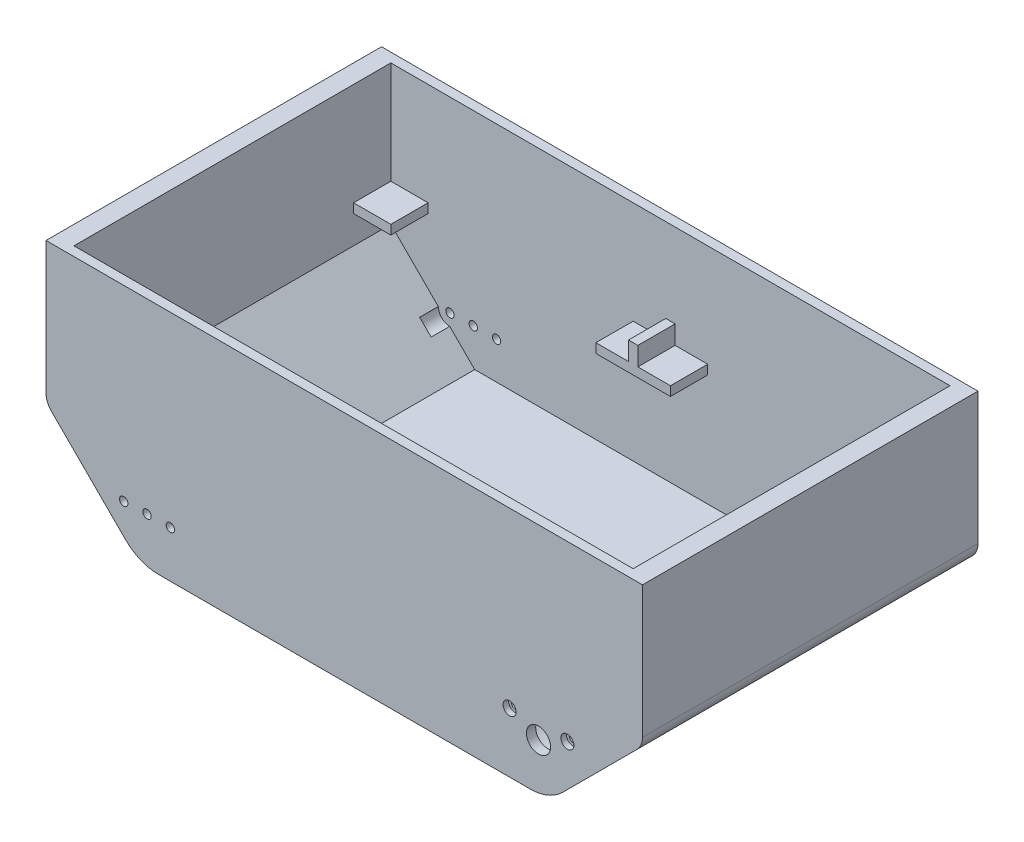
from build123d import *

# Parameters (mm, degrees)
SKETCH1_W               = 320
SKETCH1_H               = 180
BOSS_EXTRUDE1_DEPTH     = 50
CUT_EXTRUDE2_DEPTH      = 246.967477525
CUT_EXTRUDE3_DEPTH      = 170
FILLET1_R               = 25
SKETCH6_R               = 6.5
CUT_EXTRUDE4_DEPTH      = 246.967477525
SKETCH11_R              = 2
CUT_EXTRUDE7_DEPTH      = 246.967477525
SKETCH12_R              = 3.5
SKETCH12_R_2            = 2
CUT_EXTRUDE8_DEPTH      = 3
BOSS_EXTRUDE2_DEPTH     = 170
SKETCH13_R              = 2.25
CUT_EXTRUDE9_DEPTH      = 246.967477525
SKETCH7_R               = 17.75
CUT_EXTRUDE11_DEPTH     = 170
CUT_EXTRUDE10_DEPTH     = 10
FILLET2_R               = 25
SKETCH15_R              = 18.75
CUT_EXTRUDE12_DEPTH     = 50
SKETCH16_W              = 320
SKETCH16_H              = 180
SKETCH16_W_2            = 300
SKETCH16_H_2            = 170
BOSS_EXTRUDE4_DEPTH     = 75
FILLET3_R               = 10
SKETCH17_W              = 20
SKETCH17_H              = 20
BOSS_EXTRUDE5_DEPTH     = 5
LPATTERN1_COUNT         = 2
LPATTERN1_PITCH         = 150
LPATTERN1_COUNT_DIR2    = 2
LPATTERN1_PITCH_DIR2    = 130
MIRROR6_COPY_1_SKETCH_W = 20
MIRROR6_COPY_1_SKETCH_H = 20
MIRROR6_COPY_1_DEPTH    = 5
MIRROR6_COPY_2_SKETCH_W = 20
MIRROR6_COPY_2_SKETCH_H = 20
MIRROR6_COPY_2_DEPTH    = 5
MIRROR6_COPY_3_SKETCH_W = 20
MIRROR6_COPY_3_SKETCH_H = 20
MIRROR6_COPY_3_DEPTH    = 5
SKETCH18_W              = 5
SKETCH18_H              = 20
BOSS_EXTRUDE6_DEPTH     = 10


with BuildPart() as part:
    # Sketch1 → Boss-Extrude1 (new body)
    with BuildSketch(Plane(origin=(0, 0, 0), x_dir=(1, 0, 0), z_dir=(0, 1, 0))):
        Rectangle(SKETCH1_W, SKETCH1_H)
    extrude(amount=BOSS_EXTRUDE1_DEPTH)

    # Sketch2 → Cut-Extrude2 (cut, through all)
    with BuildSketch(Plane.XY.offset(90)):
        Polygon((-160, 50), (-110, 0), (-160, 0), align=None)
    cut_extrude2 = extrude(amount=-CUT_EXTRUDE2_DEPTH, mode=Mode.SUBTRACT)

    # Mirror1: Cut-Extrude2 across plane
    add(cut_extrude2.mirror(Plane(origin=(0, 0, 0), x_dir=(0, 0, 1), z_dir=(1, 0, 0))), mode=Mode.SUBTRACT)

    # Sketch5 → Cut-Extrude3 (cut)
    with BuildSketch(Plane.XY.offset(85)):
        Polygon((-150, 50), (150, 50), (105, 5), (-105, 5), align=None)
    extrude(amount=-CUT_EXTRUDE3_DEPTH, mode=Mode.SUBTRACT)

    # Fillet1
    fillet1_edges = [part.edges().sort_by_distance(p)[0] for p in [
        (-110, 0, 0),
        (110, 0, 0),
    ]]
    fillet(fillet1_edges, radius=FILLET1_R)

    # Sketch6 → Cut-Extrude4 (cut, through all)
    with BuildSketch(Plane(origin=(0, 0, -90), x_dir=(-1, 0, 0), z_dir=(0, 0, -1))):
        with Locations((-104.21174675, 25)):
            Circle(SKETCH6_R)
    extrude(amount=-CUT_EXTRUDE4_DEPTH, mode=Mode.SUBTRACT)

    # Sketch11 → Cut-Extrude7 (cut, through all)
    with BuildSketch(Plane(origin=(0, 0, -90), x_dir=(-1, 0, 0), z_dir=(0, 0, -1))):
        with Locations((-88.71174675, 32)):
            Circle(SKETCH11_R)
        with Locations((-119.71174675, 32)):
            Circle(SKETCH11_R)
    extrude(amount=-CUT_EXTRUDE7_DEPTH, mode=Mode.SUBTRACT)

    # Sketch12 → Cut-Extrude8 (cut)
    # profile 1 of 2: a face of its own
    with BuildSketch(Plane(origin=(0, 0, -90), x_dir=(-1, 0, 0), z_dir=(0, 0, -1))):
        with Locations((-88.71174675, 32)):
            Circle(SKETCH12_R)
        with Locations((-88.71174675, 32)):
            Circle(SKETCH12_R_2, mode=Mode.SUBTRACT)
    # profile 2 of 2: a face of its own
    with BuildSketch(Plane(origin=(0, 0, -90), x_dir=(-1, 0, 0), z_dir=(0, 0, -1))):
        with Locations((-119.71174675, 32)):
            Circle(SKETCH12_R)
    cut_extrude8 = extrude(amount=-CUT_EXTRUDE8_DEPTH, mode=Mode.SUBTRACT)

    # Mirror3: Cut-Extrude8 across plane
    add(cut_extrude8.mirror(Plane.XY), mode=Mode.SUBTRACT)

    # Sketch8 → Boss-Extrude2 (add)
    with BuildSketch(Plane.XY.offset(-85)):
        Polygon((134.775557817, 25), (113.988971092, 4.88785045), (73.113118158, 4.88785045), (73.113118158, 25), align=None)
    extrude(amount=BOSS_EXTRUDE2_DEPTH)

    # Sketch13 → Cut-Extrude9 (cut, through all)
    with BuildSketch(Plane(origin=(0, 0, -90), x_dir=(-1, 0, 0), z_dir=(0, 0, -1))):
        with Locations((105.78825325, 25)):
            Circle(SKETCH13_R)
        with Locations((118.28825325, 24.639652806)):
            Circle(SKETCH13_R)
        with Locations((93.28825325, 25)):
            Circle(SKETCH13_R)
    extrude(amount=-CUT_EXTRUDE9_DEPTH, mode=Mode.SUBTRACT)

    # Sketch7 → Cut-Extrude11 (cut)
    with BuildSketch(Plane.XY.offset(-85)):
        with Locations((104.21174675, 32)):
            Circle(SKETCH7_R)
    extrude(amount=CUT_EXTRUDE11_DEPTH, mode=Mode.SUBTRACT)

    # Sketch14 → Cut-Extrude10 (cut)
    with BuildSketch(Plane(origin=(0, 0, 85), x_dir=(-1, 0, 0), z_dir=(0, 0, -1))):
        with BuildLine():
            Line((93.378330692, 31.249350851), (118.378330692, 30.889003656))
            ThreePointArc((118.378330692, 30.889003656), (124.537604101, 24.549575364), (118.198175808, 18.390301955))
            Line((118.198175808, 18.390301955), (93.198175808, 18.750649149))
            ThreePointArc((93.198175808, 18.750649149), (87.0389024, 25.090077442), (93.378330692, 31.249350851))
        make_face()
    cut_extrude10 = extrude(amount=CUT_EXTRUDE10_DEPTH, mode=Mode.SUBTRACT)

    # Mirror4: Cut-Extrude10 across plane
    add(cut_extrude10.mirror(Plane.XY), mode=Mode.SUBTRACT)

    # Fillet2
    # the kernel refuses this fillet: 25 mm, written as the material it adds along each edge
    with BuildSketch(Plane(origin=(125, 25, 85), x_dir=(0.7071067811865477, 0.7071067811865474, 0), z_dir=(0, 0, -1))) as fillet2_piece_1:
        with BuildLine():
            CenterArc((9.010562274, -25), FILLET2_R, 90, 29.146633508)
            Line((-3.165597468, -3.165597468), (-3.409120663, -2.728909417))
            ThreePointArc((-3.409120663, -2.728909417), (-1.936352125, -1.229245343), (-0.353553391, 0.353553391))
            Line((-0.353553391, 0.353553391), (0, 0.5))
            Line((0, 0.5), (9.010562274, 0.5))
            Line((9.010562274, 0.5), (9.010562274, 0))
        make_face()
    extrude(amount=170)

    # Sketch15 → Cut-Extrude12 (cut)
    with BuildSketch(Plane.XY.offset(-85)):
        with Locations((104.21174675, 32)):
            Circle(SKETCH15_R)
    cut_extrude12 = extrude(amount=CUT_EXTRUDE12_DEPTH, mode=Mode.SUBTRACT)

    # Mirror5: Cut-Extrude12 across plane
    add(cut_extrude12.mirror(Plane.XY), mode=Mode.SUBTRACT)

    # Sketch16 → Boss-Extrude4 (add)
    with BuildSketch(Plane(origin=(0, 50, 0), x_dir=(1, 0, 0), z_dir=(0, 1, 0))):
        Rectangle(SKETCH16_W, SKETCH16_H)
        Rectangle(SKETCH16_W_2, SKETCH16_H_2, mode=Mode.SUBTRACT)
    extrude(amount=BOSS_EXTRUDE4_DEPTH)

    # Fillet3
    fillet3_edges = [part.edges().sort_by_distance(p)[0] for p in [
        (-160, 50, 0),
        (160, 50, 0),
    ]]
    fillet(fillet3_edges, radius=FILLET3_R)

    # Sketch17 → Boss-Extrude5 (add)
    with BuildSketch(Plane(origin=(0, 65, 0), x_dir=(1, 0, 0), z_dir=(0, 1, 0))):
        with Locations((-140, 75)):
            Rectangle(SKETCH17_W, SKETCH17_H)
    boss_extrude5 = extrude(amount=BOSS_EXTRUDE5_DEPTH)

    # LPattern1: Boss-Extrude5 2 × 2
    with Locations(*[(j * LPATTERN1_PITCH_DIR2, 0, i * LPATTERN1_PITCH) for i in range(LPATTERN1_COUNT) for j in range(LPATTERN1_COUNT_DIR2) if (i, j) != (0, 0)]):
        add(boss_extrude5)

    # Mirror6: Boss-Extrude5 across plane
    add(boss_extrude5.mirror(Plane(origin=(0, 0, 0), x_dir=(0, 0, 1), z_dir=(1, 0, 0))))

    # Mirror6 copy 1 sketch → Mirror6 copy 1 (add)
    with BuildSketch(Plane(origin=(-130, 65, 0), x_dir=(-1, 0, 0), z_dir=(0, 1, 0))):
        with Locations((-140, -75)):
            Rectangle(MIRROR6_COPY_1_SKETCH_W, MIRROR6_COPY_1_SKETCH_H)
    extrude(amount=MIRROR6_COPY_1_DEPTH)

    # Mirror6 copy 2 sketch → Mirror6 copy 2 (add)
    with BuildSketch(Plane(origin=(0, 65, 150), x_dir=(-1, 0, 0), z_dir=(0, 1, 0))):
        with Locations((-140, -75)):
            Rectangle(MIRROR6_COPY_2_SKETCH_W, MIRROR6_COPY_2_SKETCH_H)
    extrude(amount=MIRROR6_COPY_2_DEPTH)

    # Mirror6 copy 3 sketch → Mirror6 copy 3 (add)
    with BuildSketch(Plane(origin=(-130, 65, 150), x_dir=(-1, 0, 0), z_dir=(0, 1, 0))):
        with Locations((-140, -75)):
            Rectangle(MIRROR6_COPY_3_SKETCH_W, MIRROR6_COPY_3_SKETCH_H)
    extrude(amount=MIRROR6_COPY_3_DEPTH)

    # Sketch18 → Boss-Extrude6 (add)
    with BuildSketch(Plane(origin=(0, 70, 0), x_dir=(1, 0, 0), z_dir=(0, 1, 0))):
        with Locations((0, 75)):
            Rectangle(SKETCH18_W, SKETCH18_H)
    boss_extrude6 = extrude(amount=BOSS_EXTRUDE6_DEPTH)

    # Mirror7: Boss-Extrude6 across plane
    add(boss_extrude6.mirror(Plane.XY))


solid = part.part
